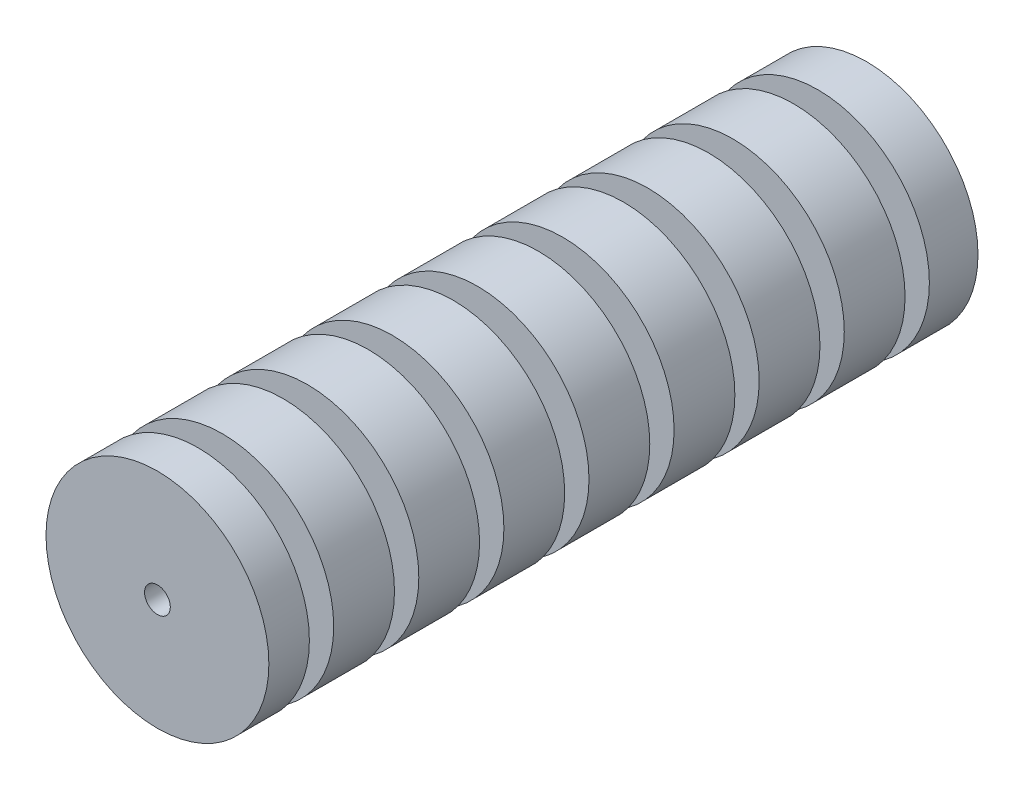
from build123d import *

# Parameters (mm, degrees)
SKETCH3_R             = 27.5
BOSS_EXTRUDE2_DEPTH   = 175
SKETCH5_R             = 3.175
CUT_EXTRUDE1_DEPTH    = 180.26935042
SKETCH4_W             = 16
SKETCH4_H             = 6
SHELL1_START          = 3
SHELL1_OUTLINE_R      = 8.5
SHELL1_OUTLINE_R_2    = 6.175
SHELL1_DEPTH          = 169
SHELL1_START_2        = 21
SHELL1_2_OUTLINE_R    = 24.5
SHELL1_2_OUTLINE_R_2  = 8.5
SHELL1_2_DEPTH        = 9
SHELL1_START_3        = 42
SHELL1_3_OUTLINE_R    = 24.5
SHELL1_3_OUTLINE_R_2  = 8.5
SHELL1_3_DEPTH        = 9
SHELL1_START_4        = 63
SHELL1_4_OUTLINE_R    = 24.5
SHELL1_4_OUTLINE_R_2  = 8.5
SHELL1_4_DEPTH        = 9
SHELL1_START_5        = 84
SHELL1_5_OUTLINE_R    = 24.5
SHELL1_5_OUTLINE_R_2  = 8.5
SHELL1_5_DEPTH        = 9
SHELL1_START_6        = 105
SHELL1_6_OUTLINE_R    = 24.5
SHELL1_6_OUTLINE_R_2  = 8.5
SHELL1_6_DEPTH        = 9
SHELL1_START_7        = 126
SHELL1_7_OUTLINE_R    = 24.5
SHELL1_7_OUTLINE_R_2  = 8.5
SHELL1_7_DEPTH        = 9
SHELL1_START_8        = 147
SHELL1_8_OUTLINE_R    = 24.5
SHELL1_8_OUTLINE_R_2  = 8.5
SHELL1_8_DEPTH        = 9
SHELL1_9_OUTLINE_R    = 24.5
SHELL1_9_OUTLINE_R_2  = 8.5
SHELL1_9_DEPTH        = 6
SHELL1_START_9        = 168
SHELL1_10_OUTLINE_R   = 24.5
SHELL1_10_OUTLINE_R_2 = 8.5
SHELL1_10_DEPTH       = 4
BOSS_EXTRUDE3_REACH   = 181.269
SKETCH11_W            = 6
SKETCH11_H            = 18.622661507
SKETCH11_H_2          = 18.562635142
SKETCH11_H_3          = 18.723636058
SKETCH11_H_4          = 19.102872432
SKETCH11_H_5          = 19.443952445
SKETCH11_H_6          = 20.46765219
SKETCH11_H_7          = 19.166783548
SKETCH11_H_8          = 20.128295153
SKETCH12_W            = 1.25
SKETCH12_H            = 4
SKETCH12_H_2          = 6
SKETCH12_H_3          = 9


# Read off the part's stored shape, not the designer's step: Shell1
with BuildPart() as part:
    # Sketch3 → Boss-Extrude2 (new body)
    with BuildSketch(Plane.XY):
        Circle(SKETCH3_R)
    extrude(amount=BOSS_EXTRUDE2_DEPTH)

    # Sketch5 → Cut-Extrude1 (cut, through all)
    with BuildSketch(Plane.XY.offset(175)):
        Circle(SKETCH5_R)
    extrude(amount=-CUT_EXTRUDE1_DEPTH, mode=Mode.SUBTRACT)

    # Sketch4 → Cut-Revolve1 (revolve, cut)
    with BuildSketch(Plane(origin=(0, 0, 0), x_dir=(1, 0, 0), z_dir=(0, 1, 0)), mode=Mode.PRIVATE) as cut_revolve1_sk:
        with Locations((-19.5, -162)):
            Rectangle(SKETCH4_W, SKETCH4_H)
        with Locations((-19.5, -141)):
            Rectangle(SKETCH4_W, SKETCH4_H)
        with Locations((-19.5, -120)):
            Rectangle(SKETCH4_W, SKETCH4_H)
        with Locations((-19.5, -99)):
            Rectangle(SKETCH4_W, SKETCH4_H)
        with Locations((-19.5, -78)):
            Rectangle(SKETCH4_W, SKETCH4_H)
        with Locations((-19.5, -57)):
            Rectangle(SKETCH4_W, SKETCH4_H)
        with Locations((-19.5, -36)):
            Rectangle(SKETCH4_W, SKETCH4_H)
        with Locations((-19.5, -15)):
            Rectangle(SKETCH4_W, SKETCH4_H)
    revolve(cut_revolve1_sk.sketch.rotate(Axis((0, 0, 175), (0, 0, -1)), 180), axis=Axis((0, 0, 175), (0, 0, -1)), mode=Mode.SUBTRACT)

    # Shell1 outline → Shell1 (cut)
    with BuildSketch(Plane.XY.offset(SHELL1_START)):
        Circle(SHELL1_OUTLINE_R)
        Circle(SHELL1_OUTLINE_R_2, mode=Mode.SUBTRACT)
    extrude(amount=SHELL1_DEPTH, mode=Mode.SUBTRACT)

    # Shell1 2 outline → Shell1 2 (cut)
    with BuildSketch(Plane.XY.offset(SHELL1_START_2)):
        Circle(SHELL1_2_OUTLINE_R)
        Circle(SHELL1_2_OUTLINE_R_2, mode=Mode.SUBTRACT)
    extrude(amount=SHELL1_2_DEPTH, mode=Mode.SUBTRACT)

    # Shell1 3 outline → Shell1 3 (cut)
    with BuildSketch(Plane.XY.offset(SHELL1_START_3)):
        Circle(SHELL1_3_OUTLINE_R)
        Circle(SHELL1_3_OUTLINE_R_2, mode=Mode.SUBTRACT)
    extrude(amount=SHELL1_3_DEPTH, mode=Mode.SUBTRACT)

    # Shell1 4 outline → Shell1 4 (cut)
    with BuildSketch(Plane.XY.offset(SHELL1_START_4)):
        Circle(SHELL1_4_OUTLINE_R)
        Circle(SHELL1_4_OUTLINE_R_2, mode=Mode.SUBTRACT)
    extrude(amount=SHELL1_4_DEPTH, mode=Mode.SUBTRACT)

    # Shell1 5 outline → Shell1 5 (cut)
    with BuildSketch(Plane.XY.offset(SHELL1_START_5)):
        Circle(SHELL1_5_OUTLINE_R)
        Circle(SHELL1_5_OUTLINE_R_2, mode=Mode.SUBTRACT)
    extrude(amount=SHELL1_5_DEPTH, mode=Mode.SUBTRACT)

    # Shell1 6 outline → Shell1 6 (cut)
    with BuildSketch(Plane.XY.offset(SHELL1_START_6)):
        Circle(SHELL1_6_OUTLINE_R)
        Circle(SHELL1_6_OUTLINE_R_2, mode=Mode.SUBTRACT)
    extrude(amount=SHELL1_6_DEPTH, mode=Mode.SUBTRACT)

    # Shell1 7 outline → Shell1 7 (cut)
    with BuildSketch(Plane.XY.offset(SHELL1_START_7)):
        Circle(SHELL1_7_OUTLINE_R)
        Circle(SHELL1_7_OUTLINE_R_2, mode=Mode.SUBTRACT)
    extrude(amount=SHELL1_7_DEPTH, mode=Mode.SUBTRACT)

    # Shell1 8 outline → Shell1 8 (cut)
    with BuildSketch(Plane.XY.offset(SHELL1_START_8)):
        Circle(SHELL1_8_OUTLINE_R)
        Circle(SHELL1_8_OUTLINE_R_2, mode=Mode.SUBTRACT)
    extrude(amount=SHELL1_8_DEPTH, mode=Mode.SUBTRACT)

    # Shell1 9 outline → Shell1 9 (cut)
    with BuildSketch(Plane.XY.offset(SHELL1_START)):
        Circle(SHELL1_9_OUTLINE_R)
        Circle(SHELL1_9_OUTLINE_R_2, mode=Mode.SUBTRACT)
    extrude(amount=SHELL1_9_DEPTH, mode=Mode.SUBTRACT)

    # Shell1 10 outline → Shell1 10 (cut)
    with BuildSketch(Plane.XY.offset(SHELL1_START_9)):
        Circle(SHELL1_10_OUTLINE_R)
        Circle(SHELL1_10_OUTLINE_R_2, mode=Mode.SUBTRACT)
    extrude(amount=SHELL1_10_DEPTH, mode=Mode.SUBTRACT)

    # Boss-Extrude3: up to this face of the body (flat: up to its plane)
    boss_extrude3_end = Plane(part.part.faces().sort_by_distance((-26.722182541, 0, 175))[0])
    # Sketch10 → Boss-Extrude3 (add, up to the picked face)
    with BuildSketch(Plane(origin=(0, 0, 0), x_dir=(-1, 0, 0), z_dir=(0, 0, -1)), mode=Mode.PRIVATE) as boss_extrude3_sk1:
        with BuildLine():
            Line((-1, 27.481812167), (-1, 3.01340754))
            ThreePointArc((-1, 3.01340754), (0, 3.175), (1, 3.01340754))
            Line((1, 3.01340754), (1, 27.481812167))
            ThreePointArc((1, 27.481812167), (0, 27.5), (-1, 27.481812167))
        make_face()
    boss_extrude3_tool1 = split(extrude(boss_extrude3_sk1.sketch, amount=-BOSS_EXTRUDE3_REACH, mode=Mode.PRIVATE), bisect_by=boss_extrude3_end, keep=Keep.BOTH, mode=Mode.PRIVATE)
    # Sketch10 → Boss-Extrude3 (add, up to the picked face)
    with BuildSketch(Plane(origin=(0, 0, 0), x_dir=(-1, 0, 0), z_dir=(0, 0, -1)), mode=Mode.PRIVATE) as boss_extrude3_sk2:
        with BuildLine():
            Line((3.01340754, 1), (27.481812167, 1))
            ThreePointArc((27.481812167, 1), (27.5, 0), (27.481812167, -1))
            Line((27.481812167, -1), (3.01340754, -1))
            ThreePointArc((3.01340754, -1), (3.175, 0), (3.01340754, 1))
        make_face()
    boss_extrude3_tool2 = split(extrude(boss_extrude3_sk2.sketch, amount=-BOSS_EXTRUDE3_REACH, mode=Mode.PRIVATE), bisect_by=boss_extrude3_end, keep=Keep.BOTH, mode=Mode.PRIVATE)
    # Sketch10 → Boss-Extrude3 (add, up to the picked face)
    with BuildSketch(Plane(origin=(0, 0, 0), x_dir=(-1, 0, 0), z_dir=(0, 0, -1)), mode=Mode.PRIVATE) as boss_extrude3_sk3:
        with BuildLine():
            Line((-1, -3.01340754), (-1, -27.481812167))
            ThreePointArc((-1, -27.481812167), (0, -27.5), (1, -27.481812167))
            Line((1, -27.481812167), (1, -3.01340754))
            ThreePointArc((1, -3.01340754), (0, -3.175), (-1, -3.01340754))
        make_face()
    boss_extrude3_tool3 = split(extrude(boss_extrude3_sk3.sketch, amount=-BOSS_EXTRUDE3_REACH, mode=Mode.PRIVATE), bisect_by=boss_extrude3_end, keep=Keep.BOTH, mode=Mode.PRIVATE)
    # Sketch10 → Boss-Extrude3 (add, up to the picked face)
    with BuildSketch(Plane(origin=(0, 0, 0), x_dir=(-1, 0, 0), z_dir=(0, 0, -1)), mode=Mode.PRIVATE) as boss_extrude3_sk4:
        with BuildLine():
            Line((-27.481812167, -1), (-3.01340754, -1))
            ThreePointArc((-3.01340754, -1), (-3.175, 0), (-3.01340754, 1))
            Line((-3.01340754, 1), (-27.481812167, 1))
            ThreePointArc((-27.481812167, 1), (-27.5, 0), (-27.481812167, -1))
        make_face()
    boss_extrude3_tool4 = split(extrude(boss_extrude3_sk4.sketch, amount=-BOSS_EXTRUDE3_REACH, mode=Mode.PRIVATE), bisect_by=boss_extrude3_end, keep=Keep.BOTH, mode=Mode.PRIVATE)
    add(boss_extrude3_tool1.solids().sort_by(Axis((0, 15.307771, 0), (0, 0, 1)))[0])
    add(boss_extrude3_tool2.solids().sort_by(Axis((-15.307771, 0, 0), (0, 0, 1)))[0])
    add(boss_extrude3_tool3.solids().sort_by(Axis((0, -15.307771, 0), (0, 0, 1)))[0])
    add(boss_extrude3_tool4.solids().sort_by(Axis((15.307771, 0, 0), (0, 0, 1)))[0])

    # Sketch11 → Cut-Revolve2 (revolve, cut)
    with BuildSketch(Plane(origin=(0, 0, 0), x_dir=(0, 0, -1), z_dir=(1, 0, 0)), mode=Mode.PRIVATE) as cut_revolve2_sk:
        with Locations((-162, 20.76776999)):
            Rectangle(SKETCH11_W, SKETCH11_H)
        with Locations((-141, 20.737756808)):
            Rectangle(SKETCH11_W, SKETCH11_H_2)
        with Locations((-120, 20.837335447)):
            Rectangle(SKETCH11_W, SKETCH11_H_3)
        with Locations((-99, 21.007875453)):
            Rectangle(SKETCH11_W, SKETCH11_H_4)
        with Locations((-78, 21.197493641)):
            Rectangle(SKETCH11_W, SKETCH11_H_5)
        with Locations((-57, 21.690265332)):
            Rectangle(SKETCH11_W, SKETCH11_H_6)
        with Locations((-36, 21.039831011)):
            Rectangle(SKETCH11_W, SKETCH11_H_7)
        with Locations((-15, 21.520586814)):
            Rectangle(SKETCH11_W, SKETCH11_H_8)
    revolve(cut_revolve2_sk.sketch.rotate(Axis((0, 0, 174.128746248), (0, 0, -1)), 90), axis=Axis((0, 0, 174.128746248), (0, 0, -1)), mode=Mode.SUBTRACT)

    # Sketch12 → Revolve1 (revolve)
    with BuildSketch(Plane(origin=(0, 0, 0), x_dir=(1, 0, 0), z_dir=(0, 1, 0))):
        with Locations((24.10458333, -170)):
            Rectangle(SKETCH12_W, SKETCH12_H)
        with Locations((24.10458333, -6)):
            Rectangle(SKETCH12_W, SKETCH12_H_2)
        with Locations((24.10458333, -151.5)):
            Rectangle(SKETCH12_W, SKETCH12_H_3)
        with Locations((24.10458333, -130.5)):
            Rectangle(SKETCH12_W, SKETCH12_H_3)
        with Locations((24.10458333, -109.5)):
            Rectangle(SKETCH12_W, SKETCH12_H_3)
        with Locations((24.10458333, -88.5)):
            Rectangle(SKETCH12_W, SKETCH12_H_3)
        with Locations((24.10458333, -67.5)):
            Rectangle(SKETCH12_W, SKETCH12_H_3)
        with Locations((24.10458333, -46.5)):
            Rectangle(SKETCH12_W, SKETCH12_H_3)
        with Locations((24.10458333, -25.5)):
            Rectangle(SKETCH12_W, SKETCH12_H_3)
    revolve(axis=Axis((0, 0, 0), (0, 0, 1)))


solid = part.part
